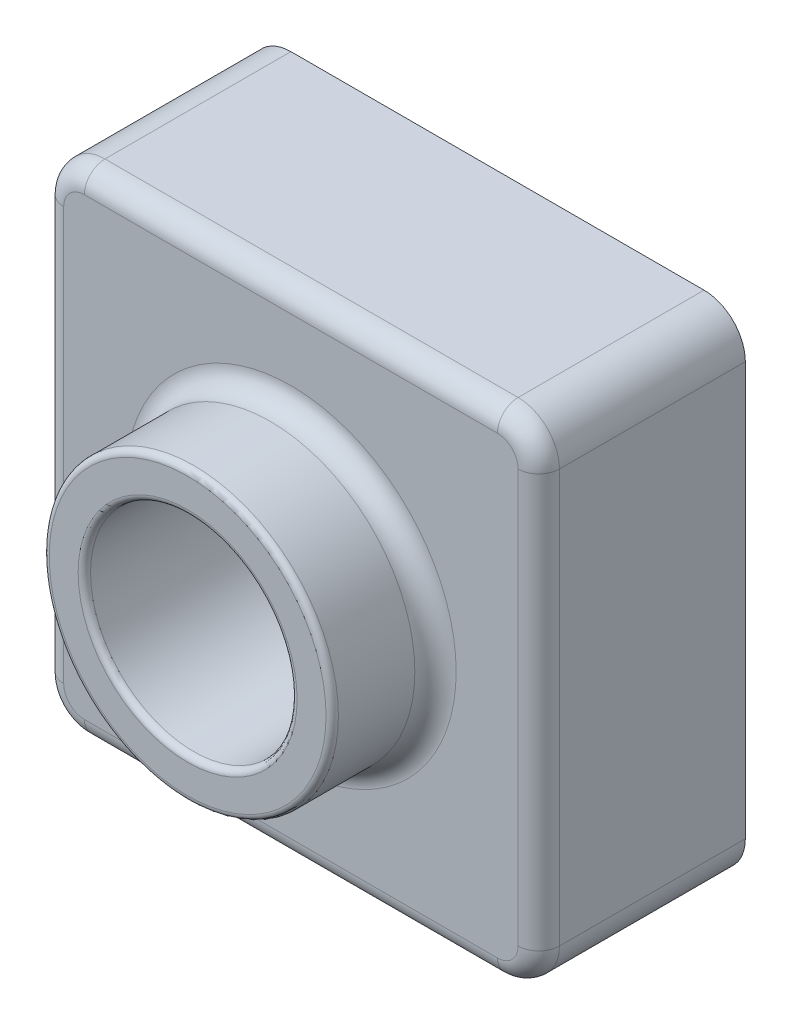
from build123d import *

# Parameters (mm, degrees)
SKETCH1_W           = 120
SKETCH1_H           = 120
BOSS_EXTRUDE1_DEPTH = 50
SKETCH2_R           = 35
BOSS_EXTRUDE2_DEPTH = 25
SKETCH3_R           = 25
CUT_EXTRUDE1_DEPTH  = 135.820665313
FILLET2_R           = 10
FILLET3_R           = 1.5
FILLET4_R           = 5
SHELL1_T            = -2


with BuildPart() as part:
    # Sketch1 → Boss-Extrude1 (new body)
    with BuildSketch(Plane.XY):
        with Locations((4.629080119, -31.513353116)):
            Rectangle(SKETCH1_W, SKETCH1_H)
    extrude(amount=BOSS_EXTRUDE1_DEPTH)

    # Sketch2 → Boss-Extrude2 (add)
    with BuildSketch(Plane.XY.offset(50)):
        with Locations((4.629080119, -31.513353116)):
            Circle(SKETCH2_R)
    extrude(amount=BOSS_EXTRUDE2_DEPTH)

    # Sketch3 → Cut-Extrude1 (cut, through all)
    with BuildSketch(Plane.XY.offset(75)):
        with Locations((4.629080119, -31.513353116)):
            Circle(SKETCH3_R)
    extrude(amount=-CUT_EXTRUDE1_DEPTH, mode=Mode.SUBTRACT)

    # Fillet2
    fillet2_edges = [part.edges().sort_by_distance(p)[0] for p in [
        (-55.370919881, -91.513353116, 25),
        (64.629080119, -91.513353116, 25),
        (-55.370919881, 28.486646884, 25),
        (64.629080119, 28.486646884, 25),
    ]]
    fillet(fillet2_edges, radius=FILLET2_R)

    # Fillet3
    fillet3_edges = [part.edges().sort_by_distance(p)[0] for p in [
        (-30.370919881, -31.513353116, 75),
        (-20.370919881, -31.513353116, 75),
    ]]
    fillet(fillet3_edges, radius=FILLET3_R)

    # Fillet4
    fillet4_edges = [part.edges().sort_by_distance(p)[0] for p in [
        (-52.441987693, 25.557714696, 50),
        (4.629080119, 28.486646884, 50),
        (61.700147931, 25.557714696, 50),
        (64.629080119, -31.513353116, 50),
        (61.700147931, -88.584420928, 50),
        (4.629080119, -91.513353116, 50),
        (-52.441987693, -88.584420928, 50),
        (-55.370919881, -31.513353116, 50),
        (-30.370919881, -31.513353116, 50),
    ]]
    fillet(fillet4_edges, radius=FILLET4_R)

    # Shell1
    shell1_openings = [part.faces().sort_by_distance(p)[0] for p in [
        (4.629080119, 26.789590609, 0),
    ]]
    offset(amount=SHELL1_T, openings=shell1_openings, kind=Kind.INTERSECTION)


solid = part.part
